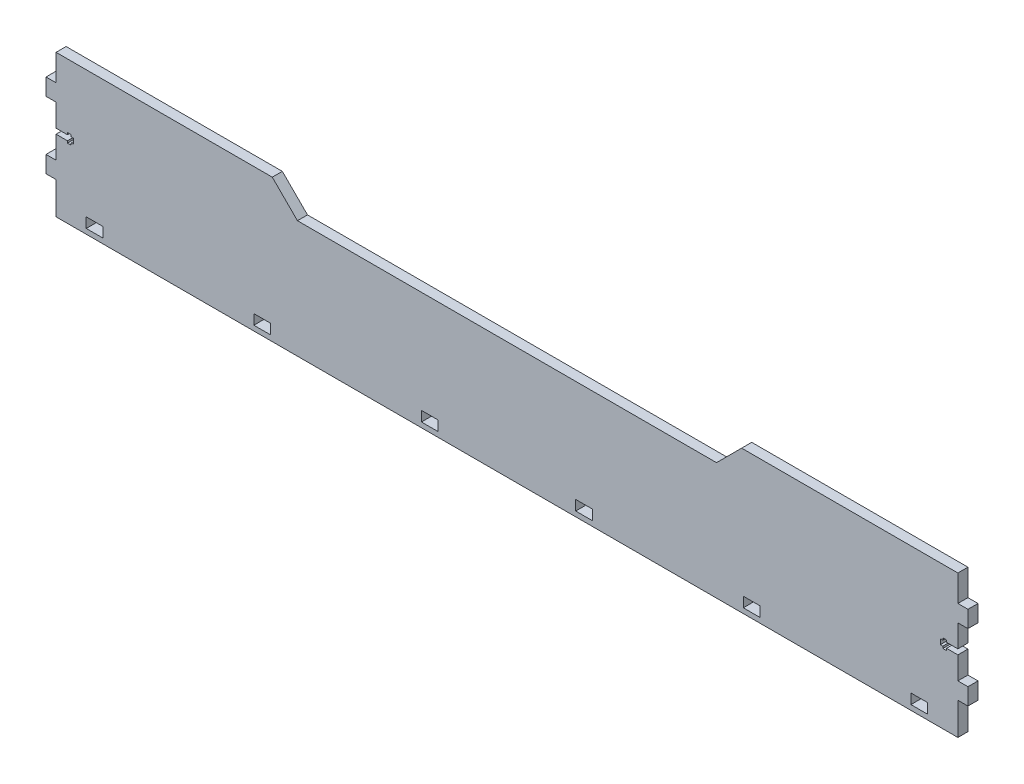
from build123d import *

# Parameters (mm, degrees)
SKETCH_1_W      = 10
SKETCH_1_H      = 6
EXTRUDE_1_DEPTH = 6


with BuildPart() as part:
    # Эскиз1 → Бобышка-Вытянуть1 (new body)
    with BuildSketch(Plane.XY):
        Polygon((-177.586230906, 18.158874443), (-48.586230906, 18.158874443), (-33.586230906, 3.158874443), (216.413769094, 3.158874443), (231.413769094, 18.158874443), (360.413769094, 18.158874443), (360.413769094, 2.408874443), (366.413769094, 2.408874443), (366.413769094, -7.591125557), (360.413769094, -7.591125557), (360.413769094, -21.041125557), (353.613769094, -21.041125557), (353.613769094, -19.841125557), (351.413769094, -19.841125557), (351.413769094, -21.041125557), (349.913769094, -21.041125557), (349.913769094, -24.141125557), (351.413769094, -24.141125557), (351.413769094, -25.341125557), (353.613769094, -25.341125557), (353.613769094, -24.141125557), (360.413769094, -24.141125557), (360.413769094, -37.591125557), (366.413769094, -37.591125557), (366.413769094, -47.591125557), (360.413769094, -47.591125557), (360.413769094, -66.841125557), (-177.586230906, -66.841125557), (-177.586230906, -47.591125557), (-183.586230906, -47.591125557), (-183.586230906, -37.591125557), (-177.586230906, -37.591125557), (-177.586230906, -24.141125557), (-170.786230906, -24.141125557), (-170.786230906, -25.341125557), (-168.586230906, -25.341125557), (-168.586230906, -24.141125557), (-167.086230906, -24.141125557), (-167.086230906, -21.041125557), (-168.586230906, -21.041125557), (-168.586230906, -19.841125557), (-170.786230906, -19.841125557), (-170.786230906, -21.041125557), (-177.586230906, -21.041125557), (-177.586230906, -7.591125557), (-183.586230906, -7.591125557), (-183.586230906, 2.408874443), (-177.586230906, 2.408874443), align=None)
        with Locations((-54.586230906, -60.841125557)):
            Rectangle(SKETCH_1_W, SKETCH_1_H, mode=Mode.SUBTRACT)
        with Locations((-154.586230906, -60.841125557)):
            Rectangle(SKETCH_1_W, SKETCH_1_H, mode=Mode.SUBTRACT)
        with Locations((45.413769094, -60.841125557)):
            Rectangle(SKETCH_1_W, SKETCH_1_H, mode=Mode.SUBTRACT)
        with Locations((137.413769094, -60.841125557)):
            Rectangle(SKETCH_1_W, SKETCH_1_H, mode=Mode.SUBTRACT)
        with Locations((237.413769094, -60.841125557)):
            Rectangle(SKETCH_1_W, SKETCH_1_H, mode=Mode.SUBTRACT)
        with Locations((337.413769094, -60.841125557)):
            Rectangle(SKETCH_1_W, SKETCH_1_H, mode=Mode.SUBTRACT)
    extrude(amount=EXTRUDE_1_DEPTH)


solid = part.part
